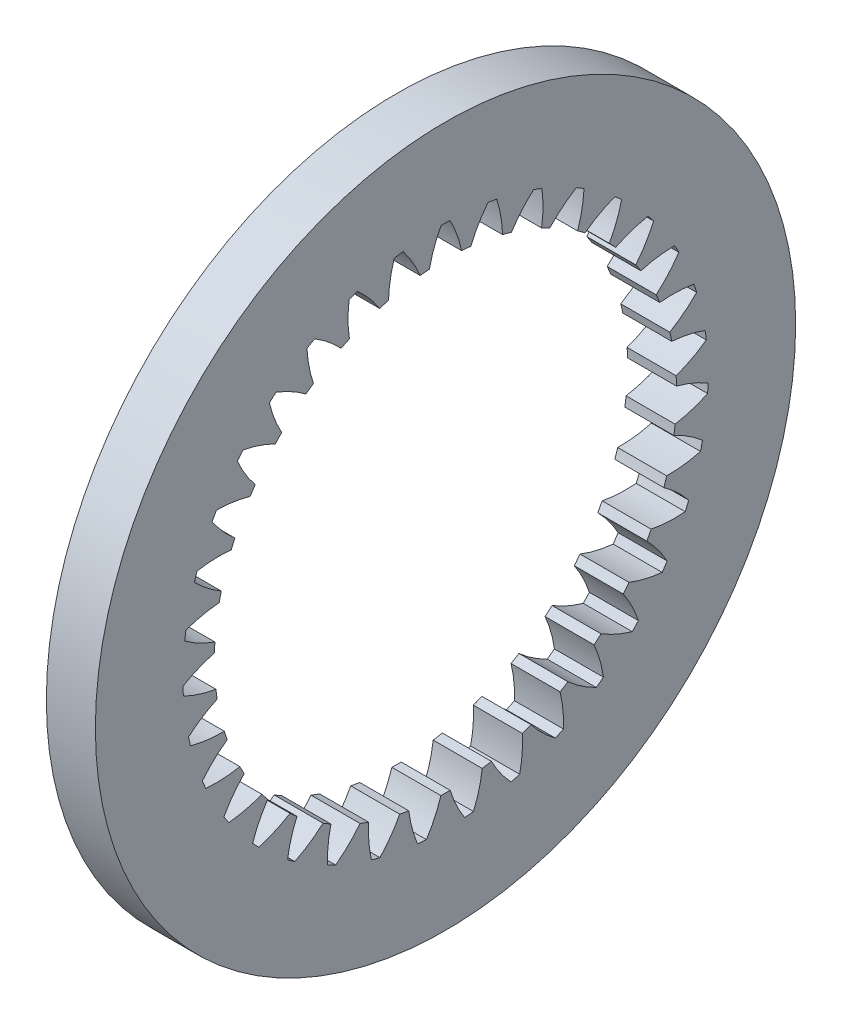
from build123d import *

# Parameters (mm, degrees)
SKETCH1_R           = 50
BOSS_EXTRUDE1_DEPTH = 7


with BuildPart() as part:
    # Sketch1 → Boss-Extrude1 (new body)
    with BuildSketch(Plane(origin=(-42.581895679, 0, 0), x_dir=(0, 0, -1), z_dir=(1, 0, 0))):
        with Locations((-27.777083352, -7.035052717)):
            Circle(SKETCH1_R)
        with BuildLine():
            ThreePointArc((-24.162682124, 25.766412247), (-23.082664784, 27.954818283), (-21.708715074, 29.971702172))
            ThreePointArc((-21.708715074, 29.971702172), (-21.08102124, 29.863290785), (-20.455259353, 29.744233496))
            ThreePointArc((-20.455259353, 29.744233496), (-19.877601945, 27.373185131), (-19.635402837, 24.944832186))
            ThreePointArc((-19.635402837, 24.944832186), (-18.997867448, 24.775721686), (-18.36383931, 24.59390295))
            ThreePointArc((-18.36383931, 24.59390295), (-16.910423307, 26.554295859), (-15.198425009, 28.2934394))
            ThreePointArc((-15.198425009, 28.2934394), (-14.600176074, 28.074691167), (-14.005728938, 27.845813078))
            ThreePointArc((-14.005728938, 27.845813078), (-13.860721755, 25.409723722), (-14.056014048, 22.977149088))
            ThreePointArc((-14.056014048, 22.977149088), (-13.458919961, 22.696919924), (-12.867545904, 22.404812994))
            ThreePointArc((-12.867545904, 22.404812994), (-11.087445224, 24.074184134), (-9.092423373, 25.479689823))
            ThreePointArc((-9.092423373, 25.479689823), (-8.54284755, 25.157635492), (-7.998821184, 24.826292933))
            ThreePointArc((-7.998821184, 24.826292933), (-8.291124878, 22.403460503), (-8.917631716, 20.044849129))
            ThreePointArc((-8.917631716, 20.044849129), (-8.380170026, 19.662508097), (-7.8504573, 19.269501531))
            ThreePointArc((-7.8504573, 19.269501531), (-5.800885844, 20.59419594), (-3.586962082, 21.620889668))
            ThreePointArc((-3.586962082, 21.620889668), (-3.10372319, 21.20588033), (-2.627603051, 20.782722924))
            ThreePointArc((-2.627603051, 20.782722924), (-3.347822739, 18.451019248), (-4.385407678, 16.242178844))
            ThreePointArc((-4.385407678, 16.242178844), (-3.924852846, 15.7700147), (-3.473826853, 15.288740051))
            ThreePointArc((-3.473826853, 15.288740051), (-1.220659533, 16.226180961), (1.141008807, 16.841063946))
            ThreePointArc((1.141008807, 16.841063946), (1.542379072, 16.346438343), (1.935290093, 15.845066716))
            ThreePointArc((1.935290093, 15.845066716), (0.810302863, 13.679434669), (-0.605011342, 11.691359184))
            ThreePointArc((-0.605011342, 11.691359184), (-0.236165979, 11.144547671), (0.121676933, 10.590473504))
            ThreePointArc((0.121676933, 10.590473504), (2.506021466, 11.110530792), (4.93952842, 11.293840189))
            ThreePointArc((4.93952842, 11.293840189), (5.246129688, 10.735495994), (5.543203106, 10.172024645))
            ThreePointArc((5.543203106, 10.172024645), (4.049606351, 8.242069422), (2.302052242, 6.538657238))
            ThreePointArc((2.302052242, 6.538657238), (2.567333142, 5.934773328), (2.820491609, 5.325708041))
            ThreePointArc((2.820491609, 5.325708041), (5.259378558, 5.411666639), (7.686509212, 5.157510734))
            ThreePointArc((7.686509212, 5.157510734), (7.888487066, 4.553393589), (8.080174697, 3.945932949))
            ThreePointArc((8.080174697, 3.945932949), (6.265973844, 2.313684899), (4.242347659, 0.949685085))
            ThreePointArc((4.242347659, 0.949685085), (4.39553775, 0.308138104), (4.53587505, -0.336342443))
            ThreePointArc((4.53587505, -0.336342443), (6.950916583, -0.687245316), (9.293660959, -1.370697744))
            ThreePointArc((9.293660959, -1.370697744), (9.384523664, -2.001171015), (9.464664511, -2.633096662))
            ThreePointArc((9.464664511, -2.633096662), (7.388169469, -3.915175743), (5.153512217, -4.895923111))
            ThreePointArc((5.153512217, -4.895923111), (5.189687844, -5.554513315), (5.21269342, -6.213694987))
            ThreePointArc((5.21269342, -6.213694987), (7.526268115, -6.990181023), (9.709328482, -8.08096325))
            ThreePointArc((9.709328482, -8.08096325), (9.686155637, -8.71752872), (9.652173906, -9.353608762))
            ThreePointArc((9.652173906, -9.353608762), (7.380124933, -10.244311798), (5.006260339, -10.810284693))
            ThreePointArc((5.006260339, -10.810284693), (4.924258786, -11.464750489), (4.829193221, -12.117446644))
            ThreePointArc((4.829193221, -12.117446644), (6.966940883, -13.294558944), (8.920151884, -14.757612332))
            ThreePointArc((8.920151884, -14.757612332), (8.783688283, -15.379810261), (8.636676176, -15.999600563))
            ThreePointArc((8.636676176, -15.999600563), (6.242098796, -16.470299625), (3.80532482, -16.603307212))
            ThreePointArc((3.80532482, -16.603307212), (3.607781686, -17.232613531), (3.397700465, -17.857845979))
            ThreePointArc((3.397700465, -17.857845979), (5.290912125, -19.397751184), (6.951495952, -21.186051993))
            ThreePointArc((6.951495952, -21.186051993), (6.706127647, -21.773884429), (6.450810253, -22.35746442))
            ThreePointArc((6.450810253, -22.35746442), (4.010668154, -22.393030854), (1.589304716, -22.088798159))
            ThreePointArc((1.589304716, -22.088798159), (1.282569199, -22.672718579), (0.964224506, -23.250391833))
            ThreePointArc((0.964224506, -23.250391833), (2.552050784, -25.103596123), (3.866634906, -27.159666895))
            ThreePointArc((3.866634906, -27.159666895), (3.520248236, -27.694240418), (3.164831666, -28.222853358))
            ThreePointArc((3.164831666, -28.222853358), (0.757553023, -27.822144028), (-1.570575263, -27.090449342))
            ThreePointArc((-1.570575263, -27.090449342), (-1.97664443, -27.610216178), (-2.393020737, -28.121763346))
            ThreePointArc((-2.393020737, -28.121763346), (-1.161613883, -30.22870321), (-0.235281281, -32.486460138))
            ThreePointArc((-0.235281281, -32.486460138), (-0.671553163, -32.950593117), (-1.115645527, -33.40724895))
            ThreePointArc((-1.115645527, -33.40724895), (-3.412688799, -32.583142985), (-5.572753975, -31.447503575))
            ThreePointArc((-5.572753975, -31.447503575), (-6.065105396, -31.886411095), (-6.566130637, -32.315390629))
            ThreePointArc((-6.566130637, -32.315390629), (-5.730721638, -34.608347287), (-5.222413648, -36.995224204))
            ThreePointArc((-5.222413648, -36.995224204), (-5.734548606, -37.373999023), (-6.25304327, -37.744020455))
            ThreePointArc((-6.25304327, -37.744020455), (-8.366022309, -36.523005299), (-10.288598102, -35.019921551))
            ThreePointArc((-10.288598102, -35.019921551), (-10.851407197, -35.363862906), (-11.420978011, -35.696487051))
            ThreePointArc((-11.420978011, -35.696487051), (-11.008417598, -38.101762989), (-10.934471658, -40.541043708))
            ThreePointArc((-10.934471658, -40.541043708), (-11.506009251, -40.822286232), (-12.082241371, -41.093780471))
            ThreePointArc((-12.082241371, -41.093780471), (-13.943243293, -39.515100554), (-15.566536535, -37.692882817))
            ThreePointArc((-15.566536535, -37.692882817), (-16.181714157, -37.930803448), (-16.801524067, -38.15638139))
            ThreePointArc((-16.801524067, -38.15638139), (-16.825072273, -40.596669061), (-17.187865066, -43.009953093))
            ThreePointArc((-17.187865066, -43.009953093), (-17.800435606, -43.184623956), (-18.415884607, -43.348864952))
            ThreePointArc((-18.415884607, -43.348864952), (-19.965095278, -41.463260347), (-21.23693199, -39.380476198))
            ThreePointArc((-21.23693199, -39.380476198), (-21.884705823, -39.504729141), (-22.53483363, -39.61601062))
            ThreePointArc((-22.53483363, -39.61601062), (-22.993733596, -42.012877169), (-23.781604662, -44.32259958))
            ThreePointArc((-23.781604662, -44.32259958), (-24.415519629, -44.385084716), (-25.050404473, -44.43679363))
            ThreePointArc((-25.050404473, -44.43679363), (-26.238030988, -42.304869219), (-27.117533291, -40.028461054))
            ThreePointArc((-27.117533291, -40.028461054), (-27.777083352, -40.035052717), (-28.436633413, -40.028461054))
            ThreePointArc((-28.436633413, -40.028461054), (-29.316135715, -42.304869219), (-30.50376223, -44.43679363))
            ThreePointArc((-30.50376223, -44.43679363), (-31.138647075, -44.385084716), (-31.772562042, -44.32259958))
            ThreePointArc((-31.772562042, -44.32259958), (-32.560433108, -42.012877169), (-33.019333073, -39.61601062))
            ThreePointArc((-33.019333073, -39.61601062), (-33.66946088, -39.504729141), (-34.317234714, -39.380476198))
            ThreePointArc((-34.317234714, -39.380476198), (-35.589071425, -41.463260347), (-37.138282096, -43.348864952))
            ThreePointArc((-37.138282096, -43.348864952), (-37.753731097, -43.184623956), (-38.366301638, -43.009953093))
            ThreePointArc((-38.366301638, -43.009953093), (-38.72909443, -40.596669061), (-38.752642636, -38.15638139))
            ThreePointArc((-38.752642636, -38.15638139), (-39.372452547, -37.930803448), (-39.987630168, -37.692882817))
            ThreePointArc((-39.987630168, -37.692882817), (-41.610923411, -39.515100554), (-43.471925333, -41.093780471))
            ThreePointArc((-43.471925333, -41.093780471), (-44.048157452, -40.822286232), (-44.619695046, -40.541043708))
            ThreePointArc((-44.619695046, -40.541043708), (-44.545749105, -38.101762989), (-44.133188693, -35.696487051))
            ThreePointArc((-44.133188693, -35.696487051), (-44.702759506, -35.363862906), (-45.265568601, -35.019921551))
            ThreePointArc((-45.265568601, -35.019921551), (-47.188144395, -36.523005299), (-49.301123433, -37.744020455))
            ThreePointArc((-49.301123433, -37.744020455), (-49.819618098, -37.373999023), (-50.331753055, -36.995224204))
            ThreePointArc((-50.331753055, -36.995224204), (-49.823445066, -34.608347287), (-48.988036066, -32.315390629))
            ThreePointArc((-48.988036066, -32.315390629), (-49.489061308, -31.886411095), (-49.981412729, -31.447503575))
            ThreePointArc((-49.981412729, -31.447503575), (-52.141477905, -32.583142985), (-54.438521176, -33.40724895))
            ThreePointArc((-54.438521176, -33.40724895), (-54.88261354, -32.950593117), (-55.318885423, -32.486460138))
            ThreePointArc((-55.318885423, -32.486460138), (-54.392552821, -30.22870321), (-53.161145967, -28.121763346))
            ThreePointArc((-53.161145967, -28.121763346), (-53.577522273, -27.610216178), (-53.983591441, -27.090449342))
            ThreePointArc((-53.983591441, -27.090449342), (-56.311719727, -27.822144028), (-58.71899837, -28.222853358))
            ThreePointArc((-58.71899837, -28.222853358), (-59.07441494, -27.694240418), (-59.42080161, -27.159666895))
            ThreePointArc((-59.42080161, -27.159666895), (-58.106217488, -25.103596123), (-56.518391209, -23.250391833))
            ThreePointArc((-56.518391209, -23.250391833), (-56.836735903, -22.672718579), (-57.14347142, -22.088798159))
            ThreePointArc((-57.14347142, -22.088798159), (-59.564834858, -22.393030854), (-62.004976956, -22.35746442))
            ThreePointArc((-62.004976956, -22.35746442), (-62.26029435, -21.773884429), (-62.505662656, -21.186051993))
            ThreePointArc((-62.505662656, -21.186051993), (-60.845078829, -19.397751184), (-58.951867168, -17.857845979))
            ThreePointArc((-58.951867168, -17.857845979), (-59.16194839, -17.232613531), (-59.359491523, -16.603307212))
            ThreePointArc((-59.359491523, -16.603307212), (-61.7962655, -16.470299625), (-64.190842879, -15.999600563))
            ThreePointArc((-64.190842879, -15.999600563), (-64.337854987, -15.379810261), (-64.474318588, -14.757612332))
            ThreePointArc((-64.474318588, -14.757612332), (-62.521107587, -13.294558944), (-60.383359925, -12.117446644))
            ThreePointArc((-60.383359925, -12.117446644), (-60.47842549, -11.464750489), (-60.560427042, -10.810284693))
            ThreePointArc((-60.560427042, -10.810284693), (-62.934291637, -10.244311798), (-65.20634061, -9.353608762))
            ThreePointArc((-65.20634061, -9.353608762), (-65.24032234, -8.71752872), (-65.263495185, -8.08096325))
            ThreePointArc((-65.263495185, -8.08096325), (-63.080434819, -6.990181023), (-60.766860124, -6.213694987))
            ThreePointArc((-60.766860124, -6.213694987), (-60.743854548, -5.554513315), (-60.707678921, -4.895923111))
            ThreePointArc((-60.707678921, -4.895923111), (-62.942336172, -3.915175743), (-65.018831215, -2.633096662))
            ThreePointArc((-65.018831215, -2.633096662), (-64.938690368, -2.001171015), (-64.847827662, -1.370697744))
            ThreePointArc((-64.847827662, -1.370697744), (-62.505083287, -0.687245316), (-60.090041754, -0.336342443))
            ThreePointArc((-60.090041754, -0.336342443), (-59.949704454, 0.308138104), (-59.796514362, 0.949685085))
            ThreePointArc((-59.796514362, 0.949685085), (-61.820140548, 2.313684899), (-63.634341401, 3.945932949))
            ThreePointArc((-63.634341401, 3.945932949), (-63.442653769, 4.553393589), (-63.240675915, 5.157510734))
            ThreePointArc((-63.240675915, 5.157510734), (-60.813545262, 5.411666639), (-58.374658313, 5.325708041))
            ThreePointArc((-58.374658313, 5.325708041), (-58.121499846, 5.934773328), (-57.856218946, 6.538657238))
            ThreePointArc((-57.856218946, 6.538657238), (-59.603773054, 8.242069422), (-61.09736981, 10.172024645))
            ThreePointArc((-61.09736981, 10.172024645), (-60.800296392, 10.735495994), (-60.493695124, 11.293840189))
            ThreePointArc((-60.493695124, 11.293840189), (-58.060188169, 11.110530792), (-55.675843637, 10.590473504))
            ThreePointArc((-55.675843637, 10.590473504), (-55.318000725, 11.144547671), (-54.949155362, 11.691359184))
            ThreePointArc((-54.949155362, 11.691359184), (-56.364469567, 13.679434669), (-57.489456797, 15.845066716))
            ThreePointArc((-57.489456797, 15.845066716), (-57.096545776, 16.346438343), (-56.69517551, 16.841063946))
            ThreePointArc((-56.69517551, 16.841063946), (-54.333507171, 16.226180961), (-52.080339851, 15.288740051))
            ThreePointArc((-52.080339851, 15.288740051), (-51.629313858, 15.7700147), (-51.168759026, 16.242178844))
            ThreePointArc((-51.168759026, 16.242178844), (-52.206343964, 18.451019248), (-52.926563653, 20.782722924))
            ThreePointArc((-52.926563653, 20.782722924), (-52.450443513, 21.20588033), (-51.967204621, 21.620889668))
            ThreePointArc((-51.967204621, 21.620889668), (-49.75328086, 20.59419594), (-47.703709403, 19.269501531))
            ThreePointArc((-47.703709403, 19.269501531), (-47.173996678, 19.662508097), (-46.636534987, 20.044849129))
            ThreePointArc((-46.636534987, 20.044849129), (-47.263041826, 22.403460503), (-47.555345519, 24.826292933))
            ThreePointArc((-47.555345519, 24.826292933), (-47.011319154, 25.157635492), (-46.461743331, 25.479689823))
            ThreePointArc((-46.461743331, 25.479689823), (-44.466721479, 24.074184134), (-42.686620799, 22.404812994))
            ThreePointArc((-42.686620799, 22.404812994), (-42.095246743, 22.696919924), (-41.498152656, 22.977149088))
            ThreePointArc((-41.498152656, 22.977149088), (-41.693444948, 25.409723722), (-41.548437766, 27.845813078))
            ThreePointArc((-41.548437766, 27.845813078), (-40.95399063, 28.074691167), (-40.355741695, 28.2934394))
            ThreePointArc((-40.355741695, 28.2934394), (-38.643743397, 26.554295859), (-37.190327394, 24.59390295))
            ThreePointArc((-37.190327394, 24.59390295), (-36.556299256, 24.775721686), (-35.918763867, 24.944832186))
            ThreePointArc((-35.918763867, 24.944832186), (-35.676564759, 27.373185131), (-35.098907351, 29.744233496))
            ThreePointArc((-35.098907351, 29.744233496), (-34.473145464, 29.863290785), (-33.84545163, 29.971702172))
            ThreePointArc((-33.84545163, 29.971702172), (-32.471501919, 27.954818283), (-31.39148458, 25.766412247))
            ThreePointArc((-31.39148458, 25.766412247), (-30.735180546, 25.832098985), (-30.077694767, 25.88465547))
            ThreePointArc((-30.077694767, 25.88465547), (-29.405788737, 28.230737463), (-28.414047488, 30.460537393))
            ThreePointArc((-28.414047488, 30.460537393), (-27.777083352, 30.465947283), (-27.140119216, 30.460537393))
            ThreePointArc((-27.140119216, 30.460537393), (-26.148377967, 28.230737463), (-25.476471936, 25.88465547))
            ThreePointArc((-25.476471936, 25.88465547), (-24.818986158, 25.832098985), (-24.162682124, 25.766412247))
        make_face(mode=Mode.SUBTRACT)
    extrude(amount=-BOSS_EXTRUDE1_DEPTH)


solid = part.part
